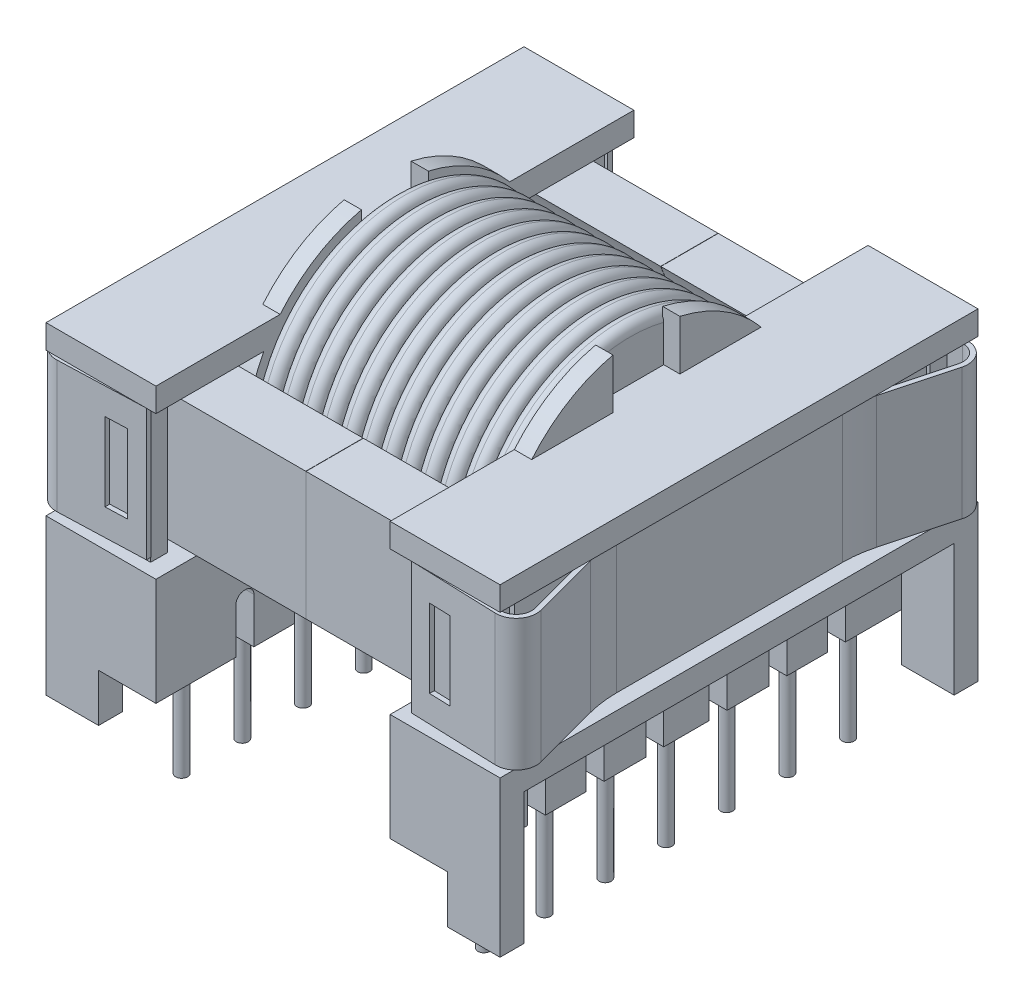
from build123d import *

# Parameters (mm, degrees)
SKETCH2_R                       = 6.75
SKETCH2_R_2                     = 5.7
BOSS_EXTRUDE1_DEPTH             = 11.25
BOSS_EXTRUDE2_DEPTH             = 1.45
SKETCH4_W                       = 40
SKETCH4_H                       = 2
BOSS_EXTRUDE3_DEPTH             = 9.2
BOSS_EXTRUDE3_2_DEPTH           = 9.2
SKETCH5_W                       = 1.4
SKETCH5_H                       = 12
BOSS_EXTRUDE4_DEPTH             = 6.15
BOSS_EXTRUDE4_2_DEPTH           = 6.15
CUT_EXTRUDE1_DEPTH              = 60.380111562
CUT_EXTRUDE1_DEPTH_BACK         = 60.380111562
SKETCH6_W                       = 4.8
SKETCH6_H                       = 4
BOSS_EXTRUDE5_REACH             = 50.229
SKETCH9_W                       = 4.8
SKETCH9_H                       = 7
BOSS_EXTRUDE5_DIRECTION_2_REACH = 50.229
CUT_EXTRUDE2_DEPTH              = 52.314911567
CUT_EXTRUDE2_DEPTH_BACK         = 52.314911567
SKETCH11_R                      = 0.5
BOSS_EXTRUDE6_DEPTH             = 9
BOSS_EXTRUDE7_START             = 0.01
SKETCH12_R                      = 5.4
BOSS_EXTRUDE7_DEPTH             = 12.15
BOSS_EXTRUDE7_2_DEPTH           = 12.15
BOSS_EXTRUDE7_3_DEPTH           = 12.15
SKETCH13_W                      = 34.5
SKETCH13_H                      = 10.7
BOSS_EXTRUDE8_DEPTH             = 5.3
EXTRUDE_THIN1_START             = 0.5
EXTRUDE_THIN1_DEPTH             = 11
SKETCH15_W                      = 1.8
SKETCH15_H                      = 6.55
CUT_EXTRUDE3_DEPTH              = 5.5
BOSS_EXTRUDE9_START             = -8.25
SKETCH16_R                      = 12.2
SKETCH16_R_2                    = 7
BOSS_EXTRUDE9_DEPTH             = 1.55
FILLET1_R                       = 0.775
LPATTERN1_COUNT                 = 12
LPATTERN1_PITCH                 = 1.65


with BuildPart() as part:
    # Sketch2 → Boss-Extrude1 (new, symmetric)
    with BuildSketch(Plane(origin=(0, 0, 0), x_dir=(0, 0, -1), z_dir=(1, 0, 0))):
        with Locations(Location((0, 27.377686874, 0), (0, 0, 180))):
            Circle(SKETCH2_R)
        with Locations(Location((0, 27.377686874, 0), (0, 0, 180))):
            Circle(SKETCH2_R_2, mode=Mode.SUBTRACT)
    extrude(amount=BOSS_EXTRUDE1_DEPTH, both=True)


with BuildPart() as body_2:
    # Sketch3 → Boss-Extrude2 (new body)
    with BuildSketch(Plane(origin=(11.25, 0, 0), x_dir=(0, 0, -1), z_dir=(1, 0, 0))):
        with BuildLine():
            Line((-2.8, 39.560051177), (-2.8, 32.342563509))
            ThreePointArc((-2.8, 32.342563509), (-5.7, 27.377686874), (-2.8, 22.412810239))
            Line((-2.8, 22.412810239), (-2.8, 21.235822337))
            ThreePointArc((-2.8, 21.235822337), (0, 20.627686874), (2.8, 21.235822337))
            Line((2.8, 21.235822337), (2.8, 22.412810239))
            ThreePointArc((2.8, 22.412810239), (5.7, 27.377686874), (2.8, 32.342563509))
            Line((2.8, 32.342563509), (2.8, 39.560051177))
            ThreePointArc((2.8, 39.560051177), (12.5, 27.377686874), (2.8, 15.195322572))
            ThreePointArc((2.8, 15.195322572), (0, 14.877686874), (-2.8, 15.195322572))
            ThreePointArc((-2.8, 15.195322572), (-12.5, 27.377686874), (-2.8, 39.560051177))
        make_face()
    extrude(amount=-BOSS_EXTRUDE2_DEPTH)


with BuildPart() as body_3:
    # Sketch4 → Boss-Extrude3 (new body)
    with BuildSketch(Plane(origin=(9.8, 0, 0), x_dir=(0, 0, -1), z_dir=(1, 0, 0))):
        with Locations((0, 34.377686874)):
            Rectangle(SKETCH4_W, SKETCH4_H)
    extrude(amount=BOSS_EXTRUDE3_DEPTH)


with BuildPart() as body_4:
    # Sketch4 → Boss-Extrude3 2 (new body)
    with BuildSketch(Plane(origin=(9.8, 0, 0), x_dir=(0, 0, -1), z_dir=(1, 0, 0))):
        Polygon((-18, 8.377686874), (-18, 19.377686874), (18, 19.377686874), (18, 8.377686874), (20, 8.377686874), (20, 21.377686874), (-20, 21.377686874), (-20, 8.377686874), align=None)
    extrude(amount=BOSS_EXTRUDE3_2_DEPTH)

    # Sketch6 → Cut-Extrude1 (cut, two sides: drawn at the far end of the back side and taken through both)
    with BuildSketch(Plane(origin=(0, 0, -20), x_dir=(-1, 0, 0), z_dir=(0, 0, -1)).offset(-CUT_EXTRUDE1_DEPTH_BACK)):
        with Locations((-12.2, 10.377686874)):
            Rectangle(SKETCH6_W, SKETCH6_H)
    extrude(amount=CUT_EXTRUDE1_DEPTH + CUT_EXTRUDE1_DEPTH_BACK, mode=Mode.SUBTRACT)


with BuildPart() as body_5:
    # Sketch5 → Boss-Extrude4 (new body)
    with BuildSketch(Plane(origin=(11.25, 0, 0), x_dir=(0, 0, -1), z_dir=(1, 0, 0))):
        with Locations((-18.3, 27.377686874)):
            Rectangle(SKETCH5_W, SKETCH5_H)
    extrude(amount=BOSS_EXTRUDE4_DEPTH)


with BuildPart() as body_6:
    # Sketch5 → Boss-Extrude4 2 (new body)
    with BuildSketch(Plane(origin=(11.25, 0, 0), x_dir=(0, 0, -1), z_dir=(1, 0, 0))):
        with Locations((18.3, 27.377686874)):
            Rectangle(SKETCH5_W, SKETCH5_H)
    extrude(amount=BOSS_EXTRUDE4_2_DEPTH)


with BuildPart() as body_7:

    # Boss-Extrude5: up to this face of the body (flat: up to its plane)
    boss_extrude5_end = Plane(body_4.part.faces().sort_by_distance((14.915121951, 14.697199069, 18))[0])
    # Sketch9 → Boss-Extrude5 (new, up to the picked face)
    with BuildSketch(Plane.XY, mode=Mode.PRIVATE) as boss_extrude5_sk1:
        with Locations((12.2, 15.877686874)):
            Rectangle(SKETCH9_W, SKETCH9_H)
    boss_extrude5_tool1 = split(extrude(boss_extrude5_sk1.sketch, amount=BOSS_EXTRUDE5_REACH, mode=Mode.PRIVATE), bisect_by=boss_extrude5_end, keep=Keep.BOTH, mode=Mode.PRIVATE)
    add(boss_extrude5_tool1.solids().sort_by(Axis((12.2, 15.877687, 0), (0, 0, 1)))[0])


    # Boss-Extrude5 direction 2: up to this face of the body (flat: up to its plane)
    boss_extrude5_direction_2_end = Plane(body_4.part.faces().sort_by_distance((14.915121951, 14.697199069, -18))[0])
    # Sketch9 → Boss-Extrude5 direction 2 (add, up to the picked face)
    with BuildSketch(Plane.XY, mode=Mode.PRIVATE) as boss_extrude5_direction_2_sk1:
        with Locations((12.2, 15.877686874)):
            Rectangle(SKETCH9_W, SKETCH9_H)
    boss_extrude5_direction_2_tool1 = split(extrude(boss_extrude5_direction_2_sk1.sketch, amount=-BOSS_EXTRUDE5_DIRECTION_2_REACH, mode=Mode.PRIVATE), bisect_by=boss_extrude5_direction_2_end, keep=Keep.BOTH, mode=Mode.PRIVATE)
    add(boss_extrude5_direction_2_tool1.solids().sort_by(Axis((12.2, 15.877687, 0), (0, 0, -1)))[0])

    # Sketch10 → Cut-Extrude2 (cut, two sides: drawn at the far end of the back side and taken through both)
    with BuildSketch(Plane(origin=(14.6, 0, 0), x_dir=(0, 0, -1), z_dir=(1, 0, 0)).offset(-CUT_EXTRUDE2_DEPTH_BACK)):
        with BuildLine():
            Line((-13.3, 12.377686874), (-11.8, 12.377686874))
            Line((-11.8, 12.377686874), (-11.8, 16.187686874))
            ThreePointArc((-11.8, 16.187686874), (-12.002096321, 16.675590553), (-12.49, 16.877686874))
            Line((-12.49, 16.877686874), (-12.61, 16.877686874))
            ThreePointArc((-12.61, 16.877686874), (-13.097903679, 16.675590553), (-13.3, 16.187686874))
            Line((-13.3, 16.187686874), (-13.3, 12.377686874))
        make_face()
        with BuildLine():
            Line((-6.9, 12.377686874), (-8.4, 12.377686874))
            Line((-8.4, 12.377686874), (-8.4, 17.187686874))
            ThreePointArc((-8.4, 17.187686874), (-8.197903679, 17.675590553), (-7.71, 17.877686874))
            Line((-7.71, 17.877686874), (-7.59, 17.877686874))
            ThreePointArc((-7.59, 17.877686874), (-7.102096321, 17.675590553), (-6.9, 17.187686874))
            Line((-6.9, 17.187686874), (-6.9, 12.377686874))
        make_face()
        with BuildLine():
            Line((-3.4, 12.377686874), (-1.9, 12.377686874))
            Line((-1.9, 12.377686874), (-1.9, 18.287686874))
            ThreePointArc((-1.9, 18.287686874), (-2.102096321, 18.775590553), (-2.59, 18.977686874))
            Line((-2.59, 18.977686874), (-2.71, 18.977686874))
            ThreePointArc((-2.71, 18.977686874), (-3.197903679, 18.775590553), (-3.4, 18.287686874))
            Line((-3.4, 18.287686874), (-3.4, 12.377686874))
        make_face()
        with BuildLine():
            Line((1.9, 12.377686874), (1.9, 18.287686874))
            ThreePointArc((1.9, 18.287686874), (2.102096321, 18.775590553), (2.59, 18.977686874))
            Line((2.59, 18.977686874), (2.71, 18.977686874))
            ThreePointArc((2.71, 18.977686874), (3.197903679, 18.775590553), (3.4, 18.287686874))
            Line((3.4, 18.287686874), (3.4, 12.377686874))
            Line((3.4, 12.377686874), (1.9, 12.377686874))
        make_face()
        with BuildLine():
            Line((8.4, 12.377686874), (8.4, 17.187686874))
            ThreePointArc((8.4, 17.187686874), (8.197903679, 17.675590553), (7.71, 17.877686874))
            Line((7.71, 17.877686874), (7.59, 17.877686874))
            ThreePointArc((7.59, 17.877686874), (7.102096321, 17.675590553), (6.9, 17.187686874))
            Line((6.9, 17.187686874), (6.9, 12.377686874))
            Line((6.9, 12.377686874), (8.4, 12.377686874))
        make_face()
        with BuildLine():
            Line((11.8, 12.377686874), (11.8, 16.187686874))
            ThreePointArc((11.8, 16.187686874), (12.002096321, 16.675590553), (12.49, 16.877686874))
            Line((12.49, 16.877686874), (12.61, 16.877686874))
            ThreePointArc((12.61, 16.877686874), (13.097903679, 16.675590553), (13.3, 16.187686874))
            Line((13.3, 16.187686874), (13.3, 12.377686874))
            Line((13.3, 12.377686874), (11.8, 12.377686874))
        make_face()
    extrude(amount=CUT_EXTRUDE2_DEPTH + CUT_EXTRUDE2_DEPTH_BACK, mode=Mode.SUBTRACT)


with BuildPart() as body_8:
    # Mirror1: mirrored copy
    add(body_7.part.mirror(Plane(origin=(0, 0, 0), x_dir=(0, 0, 1), z_dir=(1, 0, 0))))


with BuildPart() as body_9:
    # Mirror1 2: mirrored copy
    add(body_4.part.mirror(Plane(origin=(0, 0, 0), x_dir=(0, 0, 1), z_dir=(1, 0, 0))))


with BuildPart() as body_10:
    # Mirror1 3: mirrored copy
    add(body_5.part.mirror(Plane(origin=(0, 0, 0), x_dir=(0, 0, 1), z_dir=(1, 0, 0))))


with BuildPart() as body_11:
    # Mirror1 4: mirrored copy
    add(body_6.part.mirror(Plane(origin=(0, 0, 0), x_dir=(0, 0, 1), z_dir=(1, 0, 0))))


with BuildPart() as body_12:
    # Mirror1 5: mirrored copy
    add(body_3.part.mirror(Plane(origin=(0, 0, 0), x_dir=(0, 0, 1), z_dir=(1, 0, 0))))


with BuildPart() as body_13:
    # Mirror1 6: mirrored copy
    add(body_2.part.mirror(Plane(origin=(0, 0, 0), x_dir=(0, 0, 1), z_dir=(1, 0, 0))))


with BuildPart() as part_1:
    add(part.part)

    # Combine1: union body 2, body 3, body 6, body 5, body 7, body 8, body 9, body 4, body 10, body 11, body 12, body 13
    add(body_2.part)
    add(body_3.part)
    add(body_6.part)
    add(body_5.part)
    add(body_7.part)
    add(body_8.part)
    add(body_9.part)
    add(body_4.part)
    add(body_10.part)
    add(body_11.part)
    add(body_12.part)
    add(body_13.part)

    # Sketch11 → Boss-Extrude6 (add)
    with BuildSketch(Plane.XZ.offset(-12.377686874)):
        with Locations(Location((12.65, 15, 0), (0, 0, 90))):
            Circle(SKETCH11_R)
        with Locations(Location((12.65, 9.92, 0), (0, 0, 90))):
            Circle(SKETCH11_R)
        with Locations(Location((12.65, 4.84, 0), (0, 0, 90))):
            Circle(SKETCH11_R)
        with Locations(Location((12.65, -0.24, 0), (0, 0, 90))):
            Circle(SKETCH11_R)
        with Locations(Location((12.65, -5.32, 0), (0, 0, 90))):
            Circle(SKETCH11_R)
        with Locations(Location((12.65, -10.4, 0), (0, 0, 90))):
            Circle(SKETCH11_R)
        with Locations(Location((12.65, -15.48, 0), (0, 0, 90))):
            Circle(SKETCH11_R)
        with Locations(Location((-12.65, -15.48, 0), (0, 0, 90))):
            Circle(SKETCH11_R)
        with Locations(Location((-12.65, -10.4, 0), (0, 0, 90))):
            Circle(SKETCH11_R)
        with Locations(Location((-12.65, -5.32, 0), (0, 0, 90))):
            Circle(SKETCH11_R)
        with Locations(Location((-12.65, -0.24, 0), (0, 0, 90))):
            Circle(SKETCH11_R)
        with Locations(Location((-12.65, 4.84, 0), (0, 0, 90))):
            Circle(SKETCH11_R)
        with Locations(Location((-12.65, 9.92, 0), (0, 0, 90))):
            Circle(SKETCH11_R)
        with Locations(Location((-12.65, 15, 0), (0, 0, 90))):
            Circle(SKETCH11_R)
    extrude(amount=BOSS_EXTRUDE6_DEPTH)


with BuildPart() as body_2_2:
    # Sketch12 → Boss-Extrude7 (new body)
    with BuildSketch(Plane(origin=(0, 0, 0), x_dir=(0, 0, -1), z_dir=(1, 0, 0)).offset(BOSS_EXTRUDE7_START)):
        with Locations((0, 27.377686874)):
            Circle(SKETCH12_R)
    extrude(amount=BOSS_EXTRUDE7_DEPTH)



with BuildPart() as body_3_2:
    # Sketch12 → Boss-Extrude7 2 (new body)
    with BuildSketch(Plane(origin=(0, 0, 0), x_dir=(0, 0, -1), z_dir=(1, 0, 0)).offset(BOSS_EXTRUDE7_START)):
        with BuildLine():
            Line((17.25, 32.727686874), (17.25, 22.027686874))
            Line((17.25, 22.027686874), (12.449096353, 22.027686874))
            ThreePointArc((12.449096353, 22.027686874), (13.55, 27.377686874), (12.449096353, 32.727686874))
            Line((12.449096353, 32.727686874), (17.25, 32.727686874))
        make_face()
    extrude(amount=BOSS_EXTRUDE7_2_DEPTH)


with BuildPart() as body_4_2:
    # Sketch12 → Boss-Extrude7 3 (new body)
    with BuildSketch(Plane(origin=(0, 0, 0), x_dir=(0, 0, -1), z_dir=(1, 0, 0)).offset(BOSS_EXTRUDE7_START)):
        with BuildLine():
            Line((-17.25, 32.727686874), (-17.25, 22.027686874))
            Line((-17.25, 22.027686874), (-12.449096353, 22.027686874))
            ThreePointArc((-12.449096353, 22.027686874), (-13.55, 27.377686874), (-12.449096353, 32.727686874))
            Line((-12.449096353, 32.727686874), (-17.25, 32.727686874))
        make_face()
    extrude(amount=BOSS_EXTRUDE7_3_DEPTH)


with BuildPart() as body_2_2_1:
    add(body_2_2.part)

    add(body_3_2.part)  # Boss-Extrude8 merges body 3 2

    add(body_4_2.part)  # Boss-Extrude8 merges body 4 2
    # Sketch13 → Boss-Extrude8 (add)
    with BuildSketch(Plane(origin=(12.16, 0, 0), x_dir=(0, 0, -1), z_dir=(1, 0, 0))):
        with Locations((0, 27.377686874)):
            Rectangle(SKETCH13_W, SKETCH13_H)
    extrude(amount=BOSS_EXTRUDE8_DEPTH)


with BuildPart() as body_3_3:
    # Sketch14 → Extrude-Thin1 (new body)
    with BuildSketch(Plane(origin=(0, 21.377686874, 0), x_dir=(1, 0, 0), z_dir=(0, 1, 0)).offset(EXTRUDE_THIN1_START)):
        with BuildLine():
            Line((11.11032338, 19.094960904), (18.361214439, 19.350123723))
            ThreePointArc((18.361214439, 19.350123723), (19.424215416, 18.860334005), (19.662637423, 17.714463161))
            Line((19.662637423, 17.714463161), (18.153340878, 12.081691772))
            ThreePointArc((18.153340878, 12.081691772), (17.89304672, 10.773104673), (17.805784306, 9.441737512))
            Line((17.805784306, 9.441737512), (17.805784306, -9.441737512))
            ThreePointArc((17.805784306, -9.441737512), (17.89304672, -10.773104673), (18.153340878, -12.081691772))
            Line((18.153340878, -12.081691772), (19.662637423, -17.714463161))
            ThreePointArc((19.662637423, -17.714463161), (19.424215416, -18.860334005), (18.361214439, -19.350123723))
            Line((18.361214439, -19.350123723), (11.11032338, -19.094960904))
            Line((11.11032338, -19.094960904), (11.09625587, -19.494713459))
            Line((11.09625587, -19.494713459), (18.347146928, -19.749876277))
            ThreePointArc((18.347146928, -19.749876277), (19.73722513, -19.109382032), (20.049007753, -17.610935542))
            Line((20.049007753, -17.610935542), (18.539711209, -11.978164154))
            ThreePointArc((18.539711209, -11.978164154), (18.289624665, -10.720894196), (18.205784306, -9.441737512))
            Line((18.205784306, -9.441737512), (18.205784306, 9.441737512))
            ThreePointArc((18.205784306, 9.441737512), (18.289624665, 10.720894196), (18.539711209, 11.978164154))
            Line((18.539711209, 11.978164154), (20.049007753, 17.610935542))
            ThreePointArc((20.049007753, 17.610935542), (19.73722513, 19.109382032), (18.347146928, 19.749876277))
            Line((18.347146928, 19.749876277), (11.09625587, 19.494713459))
            Line((11.09625587, 19.494713459), (11.11032338, 19.094960904))
        make_face()
    extrude(amount=EXTRUDE_THIN1_DEPTH)

    # Sketch15 → Cut-Extrude3 (cut, symmetric)
    with BuildSketch(Plane(origin=(-0.671456783, 0, -19.080601221), x_dir=(-0.9993813872183502, 0, 0.03516877708317608), z_dir=(-0.03516877708317608, 0, -0.9993813872183502))):
        with Locations((-14.224996816, 27.377686874)):
            Rectangle(SKETCH15_W, SKETCH15_H)
    cut_extrude3 = extrude(amount=CUT_EXTRUDE3_DEPTH, both=True, mode=Mode.SUBTRACT)

    # Mirror2: Cut-Extrude3 across plane
    add(cut_extrude3.mirror(Plane.XY), mode=Mode.SUBTRACT)


with BuildPart() as body_4_3:
    # Mirror3: mirrored copy
    add(body_2_2_1.part.mirror(Plane(origin=(0, 0, 0), x_dir=(0, 0, 1), z_dir=(1, 0, 0))))


with BuildPart() as body_5_2:
    # Mirror3 2: mirrored copy
    add(body_3_3.part.mirror(Plane(origin=(0, 0, 0), x_dir=(0, 0, 1), z_dir=(1, 0, 0))))


with BuildPart() as body_6_2:
    # Sketch16 → Boss-Extrude9 (new body)
    with BuildSketch(Plane(origin=(0, 0, 0), x_dir=(0, 0, -1), z_dir=(1, 0, 0)).offset(BOSS_EXTRUDE9_START)):
        with Locations(Location((0, 27.377686874, 0), (0, 0, 180))):
            Circle(SKETCH16_R)
        with Locations(Location((0, 27.377686874, 0), (0, 0, 180))):
            Circle(SKETCH16_R_2, mode=Mode.SUBTRACT)
    extrude(amount=-BOSS_EXTRUDE9_DEPTH)

    # Fillet1
    fillet1_edges = [body_6_2.edges().sort_by_distance(p)[0] for p in [
        (-9.8, 27.377686874, -12.2),
        (-8.25, 27.377686874, -12.2),
    ]]
    fillet(fillet1_edges, radius=FILLET1_R - 0.0001)  # a hair under: the kernel refuses the full size


with BuildPart() as lpattern1_1:
    # LPattern1: pattern copy
    add(body_6_2.part.moved(Location(Vector(1, 0, 0) * (1 * LPATTERN1_PITCH))))


with BuildPart() as lpattern1_2:
    # LPattern1: pattern copy
    add(body_6_2.part.moved(Location(Vector(1, 0, 0) * (2 * LPATTERN1_PITCH))))


with BuildPart() as lpattern1_3:
    # LPattern1: pattern copy
    add(body_6_2.part.moved(Location(Vector(1, 0, 0) * (3 * LPATTERN1_PITCH))))


with BuildPart() as lpattern1_4:
    # LPattern1: pattern copy
    add(body_6_2.part.moved(Location(Vector(1, 0, 0) * (4 * LPATTERN1_PITCH))))


with BuildPart() as lpattern1_5:
    # LPattern1: pattern copy
    add(body_6_2.part.moved(Location(Vector(1, 0, 0) * (5 * LPATTERN1_PITCH))))


with BuildPart() as lpattern1_6:
    # LPattern1: pattern copy
    add(body_6_2.part.moved(Location(Vector(1, 0, 0) * (6 * LPATTERN1_PITCH))))


with BuildPart() as lpattern1_7:
    # LPattern1: pattern copy
    add(body_6_2.part.moved(Location(Vector(1, 0, 0) * (7 * LPATTERN1_PITCH))))


with BuildPart() as lpattern1_8:
    # LPattern1: pattern copy
    add(body_6_2.part.moved(Location(Vector(1, 0, 0) * (8 * LPATTERN1_PITCH))))


with BuildPart() as lpattern1_9:
    # LPattern1: pattern copy
    add(body_6_2.part.moved(Location(Vector(1, 0, 0) * (9 * LPATTERN1_PITCH))))


with BuildPart() as lpattern1_10:
    # LPattern1: pattern copy
    add(body_6_2.part.moved(Location(Vector(1, 0, 0) * (10 * LPATTERN1_PITCH))))


with BuildPart() as lpattern1_11:
    # LPattern1: pattern copy
    add(body_6_2.part.moved(Location(Vector(1, 0, 0) * (11 * LPATTERN1_PITCH))))


solid = Compound([part_1.part, body_2_2_1.part, body_3_3.part, body_4_3.part, body_5_2.part, body_6_2.part, lpattern1_1.part, lpattern1_2.part, lpattern1_3.part, lpattern1_4.part, lpattern1_5.part, lpattern1_6.part, lpattern1_7.part, lpattern1_8.part, lpattern1_9.part, lpattern1_10.part, lpattern1_11.part])
